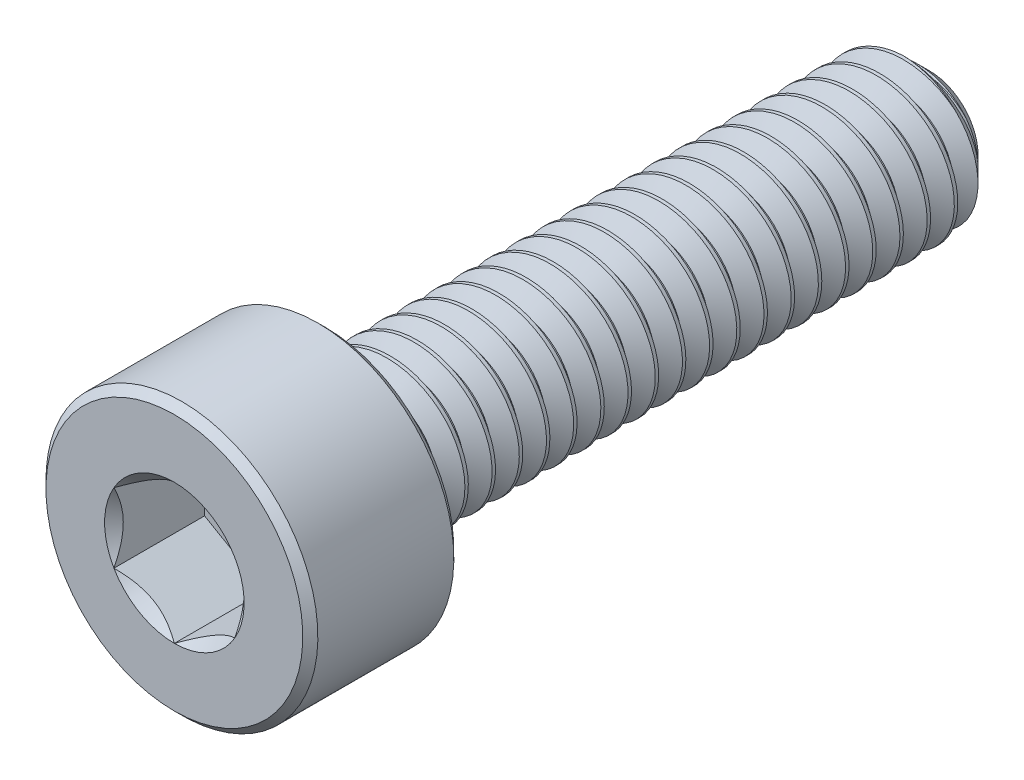
from build123d import *

# Parameters (mm, degrees)
CUT_EXTRUDE1_DEPTH = 1.5
CUT_SWEEP1_PITCH   = 0.45
CUT_SWEEP1_TO      = 10


with BuildPart() as part:
    # Sketch2 → Revolve1 (revolve)
    with BuildSketch(Plane(origin=(0, 0, 0), x_dir=(0, 0, -1), z_dir=(1, 0, 0))):
        Polygon((-6.25, 0), (-6.25, 2.125), (-6.125, 2.25), (-3.875, 2.25), (-3.75, 2.125), (-3.75, 1.25), (5.8, 1.25), (6.25, 0.8), (6.25, 0), align=None)
    revolve(axis=Axis((0, 0, -6.25), (0, 0, 1)))

    # Sketch3 → Cut-Extrude1 (cut)
    with BuildSketch(Plane.XY.offset(6.25)):
        Polygon((1, -0.577350269), (1, 0.577350269), (0, 1.154700538), (-1, 0.577350269), (-1, -0.577350269), (0, -1.154700538), align=None)
    extrude(amount=-CUT_EXTRUDE1_DEPTH, mode=Mode.SUBTRACT)

    # Cut-Extrude2 cone 1 section (through the dimple's axis) → Cut-Extrude2 (revolve, cut)
    with BuildSketch(Plane(origin=(0, 0, 6.25), x_dir=(0, -1, 0), z_dir=(1, 0, 0))):
        Polygon((0, 0), (1.154700538, 0), (0, 1.154700538), align=None)
    revolve(axis=Axis((0, 0, 6.25), (0, 0, -1)), mode=Mode.SUBTRACT)


with BuildPart() as body_2:
    # Split1: read off the stored shape, not the designer's step
    # Split1: the piece on the far side of the plane
    add(part.part)
    split(bisect_by=Plane.XY.offset(3.75), keep=Keep.BOTTOM)

    # Cut-Sweep1: arcs per turn and ends read off the stored shape
    # Cut-Sweep1: the profile of Sketch7 screwed along a right-hand helix through 23.372222 turns, 6 arcs to a turn; built about Z, then put on its axis
    cut_sweep1_z = Axis((0, 0, 0), (0, 0, 1))
    cut_sweep1_corners = [(1.274356964, 0, 0.0140625), (1.274356964, 0, -0.4078125), (0.957716426, 0, -0.225), (0.957716426, 0, -0.16875)]
    with BuildLine(mode=Mode.PRIVATE) as cut_sweep1_profile:
        Line(cut_sweep1_corners[0], cut_sweep1_corners[1])
        Line(cut_sweep1_corners[1], cut_sweep1_corners[2])
        Line(cut_sweep1_corners[2], cut_sweep1_corners[3])
        Line(cut_sweep1_corners[3], cut_sweep1_corners[0])
    cut_sweep1_cap = Face(cut_sweep1_profile.wire())
    cut_sweep1_turn_angles = [0, 30, 60, 90, 120, 150, 180, 210, 240, 270, 300, 330, 360]
    cut_sweep1_turn_weights = [1, 0.8660254037844387, 1, 0.8660254037844387, 1, 0.8660254037844387, 1, 0.8660254037844387, 1, 0.8660254037844387, 1, 0.8660254037844387, 1]
    cut_sweep1_turn_rails = [Edge.make_bspline([Vector(p[0], p[1], 0).rotate(cut_sweep1_z, cut_sweep1_turn_angles[k]) / cut_sweep1_turn_weights[k] + Vector(0, 0, p[2] + CUT_SWEEP1_PITCH * cut_sweep1_turn_angles[k] / 360) for k in range(13)], [0, 0, 0, 1, 1, 2, 2, 3, 3, 4, 4, 5, 5, 6, 6, 6], 2, cut_sweep1_turn_weights) for p in cut_sweep1_corners]
    cut_sweep1_turn_sides = [Face.make_surface_from_curves(cut_sweep1_turn_rails[p[0]], cut_sweep1_turn_rails[p[1]]) for p in [(0, 1), (1, 2), (2, 3), (3, 0)]]
    cut_sweep1_last_angles = [8280, 8310, 8340, 8370, 8400, 8407, 8414]
    cut_sweep1_last_weights = [1, 0.8660254037844387, 1, 0.8660254037844387, 1, 0.9925461516412795, 1]
    cut_sweep1_last_rails = [Edge.make_bspline([Vector(p[0], p[1], 0).rotate(cut_sweep1_z, cut_sweep1_last_angles[k]) / cut_sweep1_last_weights[k] + Vector(0, 0, p[2] + CUT_SWEEP1_PITCH * cut_sweep1_last_angles[k] / 360) for k in range(7)], [0, 0, 0, 1, 1, 2, 2, 3, 3, 3], 2, cut_sweep1_last_weights) for p in cut_sweep1_corners]
    cut_sweep1_last_sides = [Face.make_surface_from_curves(cut_sweep1_last_rails[p[0]], cut_sweep1_last_rails[p[1]]) for p in [(0, 1), (1, 2), (2, 3), (3, 0)]]
    cut_sweep1 = Plane(origin=(0, 0, -6.25), x_dir=(0, 1, 0), z_dir=(0, 0, 1)) * split(Solid(Shell([*[p.moved(Location((0, 0, CUT_SWEEP1_PITCH * i))) for i in range(23) for p in cut_sweep1_turn_sides], *cut_sweep1_last_sides, cut_sweep1_cap, cut_sweep1_cap.rotate(cut_sweep1_z, 8414).moved(Location((0, 0, CUT_SWEEP1_PITCH * 8414 / 360)))])), bisect_by=Plane.XY.offset(CUT_SWEEP1_TO), keep=Keep.BOTTOM, mode=Mode.PRIVATE)
    add(cut_sweep1, mode=Mode.SUBTRACT)


with BuildPart() as part_1:
    add(part.part)

    # Split1
    split(bisect_by=Plane.XY.offset(3.75), keep=Keep.TOP)

    add(body_2.part)  # Boss-Extrude1 merges body 2
    # Boss-Extrude1: read off the stored shape, not the designer's step
    # Boss-Extrude1 outline → Boss-Extrude1 (revolve)
    with BuildSketch(Plane.XZ):
        Polygon((0.957713627, 3.75), (0.957713627, 3.457713627), (1.25, 3.75), align=None)
    revolve(axis=Axis((0, 0, 0), (0, 0, 1)))


solid = part_1.part
